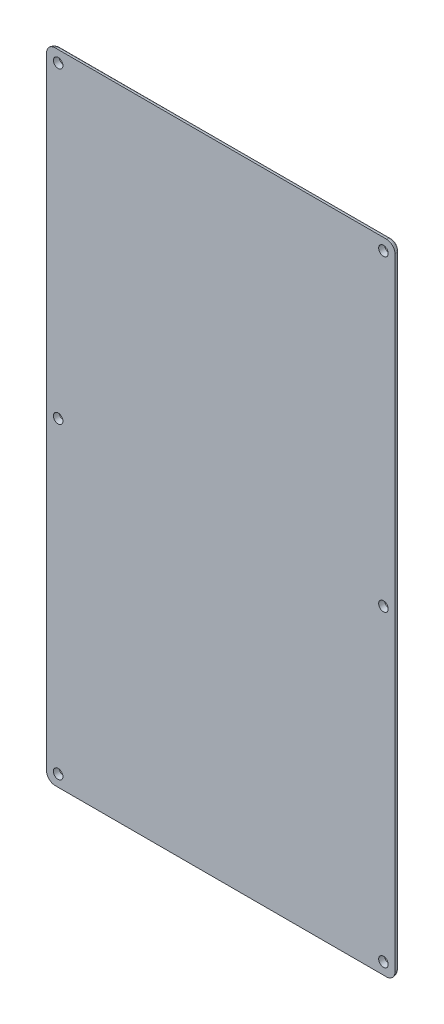
from build123d import *

# Parameters (mm, degrees)
SKETCH1_W           = 120
SKETCH1_H           = 220
BOSS_EXTRUDE1_DEPTH = 2
SKETCH3_R           = 1.65
CUT_EXTRUDE1_DEPTH  = 126.315601583
FILLET3_R           = 3
FILLET1_R           = 2


with BuildPart() as part:
    # Sketch1 → Boss-Extrude1 (new body)
    with BuildSketch(Plane.XY):
        Rectangle(SKETCH1_W, SKETCH1_H)
    extrude(amount=BOSS_EXTRUDE1_DEPTH)

    # Sketch3 → Cut-Extrude1 (cut, through all)
    with BuildSketch(Plane.XY.offset(2)):
        with Locations((56, 106)):
            Circle(SKETCH3_R)
        with Locations((-56, 106)):
            Circle(SKETCH3_R)
        with Locations((-56, 0)):
            Circle(SKETCH3_R)
        with Locations((-56, -106)):
            Circle(SKETCH3_R)
        with Locations((56, -106)):
            Circle(SKETCH3_R)
        with Locations((56, 0)):
            Circle(SKETCH3_R)
    extrude(amount=-CUT_EXTRUDE1_DEPTH, mode=Mode.SUBTRACT)

    # Fillet3
    fillet3_edges = [part.edges().sort_by_distance(p)[0] for p in [
        (60, -110, 1),
        (-60, -110, 1),
        (-60, 110, 1),
        (60, 110, 1),
    ]]
    fillet(fillet3_edges, radius=FILLET3_R)

    # Fillet1
    fillet1_edges = [part.edges().sort_by_distance(p)[0] for p in [
        (-60, 0, 0),
        (0, -110, 0),
        (60, 0, 0),
        (0, 110, 0),
        (59.121320344, 109.121320344, 0),
        (59.121320344, -109.121320344, 0),
        (-59.121320344, -109.121320344, 0),
        (-59.121320344, 109.121320344, 0),
    ]]
    fillet(fillet1_edges, radius=FILLET1_R - 0.0001)  # a hair under: the kernel refuses the full size


solid = part.part
